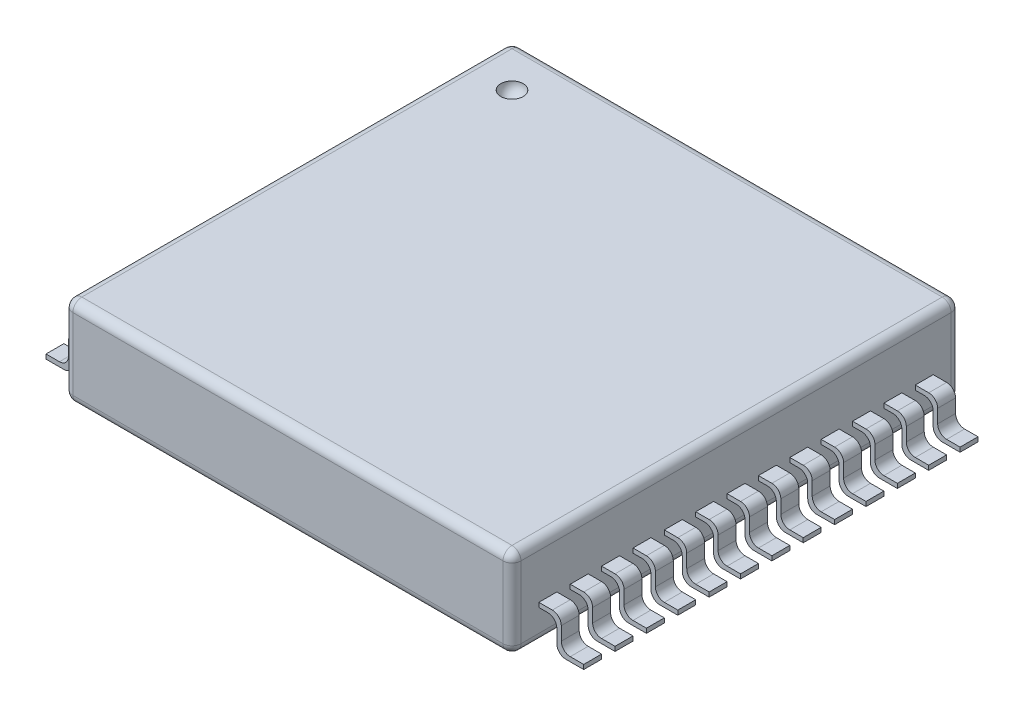
from build123d import *

# Parameters (mm, degrees)
SKETCH_1_W                         = 10
SKETCH_1_H                         = 10
EXTRUDE_1_DEPTH                    = 2
SKETCH_2_W                         = 0.4
SKETCH_2_H                         = 0.1
EXTRUDE_2_DEPTH                    = 0.2
FILLET_1_R                         = 0.2
PATTERN_LINEAR_1_COUNT             = 7
PATTERN_LINEAR_1_PITCH             = 0.7
FILLET_1_OF_PATTERN_LINEAR_1_R     = 0.2
PATTERN_LINEAR_1_COL_COUNT         = 7
PATTERN_LINEAR_1_COL_PITCH         = 0.7
FILLET_1_OF_PATTERN_LINEAR_1_COL_R = 0.2
FILLET_2_R                         = 0.2


# Read off the part's stored shape, not the designer's step: 镜向1
with BuildPart() as part:
    # 草图1 → 凸台-拉伸1 (new body)
    with BuildSketch(Plane(origin=(0, 0, 0), x_dir=(1, 0, 0), z_dir=(0, 1, 0))):
        Rectangle(SKETCH_1_W, SKETCH_1_H)
    extrude(amount=EXTRUDE_1_DEPTH)

    # 草图2 → 凸台-拉伸2 (add, symmetric)
    with BuildSketch(Plane.XY):
        Polygon((5.5, 0.8), (5.4, 0.8), (5.4, 0.7), (5.4, 0), (6, 0), (6, 0.1), (5.5, 0.1), align=None)
        with Locations((5.2, 0.75)):
            Rectangle(SKETCH_2_W, SKETCH_2_H)
    extrude_2 = extrude(amount=EXTRUDE_2_DEPTH, both=True)

    # 圆角1
    fillet_1_edges = [part.edges().sort_by_distance(p)[0] for p in [
        (5.4, 0.7, 0),
        (5.4, 0, 0),
        (5.5, 0.1, 0),
        (5.5, 0.8, 0),
    ]]
    fillet(fillet_1_edges, radius=FILLET_1_R)

    # 阵列(线性)1: 凸台-拉伸2 ×7
    with Locations(*[(0, 0, i * PATTERN_LINEAR_1_PITCH) for i in range(1, PATTERN_LINEAR_1_COUNT)]):
        add(extrude_2)

    # 圆角1 of 阵列(线性)1
    fillet_1_of_pattern_linear_1_edges = [part.edges().sort_by_distance(p)[0] for p in [
        (5.4, 0.7, 0.7),
        (5.4, 0, 0.7),
        (5.5, 0.1, 0.7),
        (5.5, 0.8, 0.7),
        (5.4, 0.7, 1.4),
        (5.4, 0, 1.4),
        (5.5, 0.1, 1.4),
        (5.5, 0.8, 1.4),
        (5.4, 0.7, 2.1),
        (5.4, 0, 2.1),
        (5.5, 0.1, 2.1),
        (5.5, 0.8, 2.1),
        (5.4, 0.7, 2.8),
        (5.4, 0, 2.8),
        (5.5, 0.1, 2.8),
        (5.5, 0.8, 2.8),
        (5.4, 0.7, 3.5),
        (5.4, 0, 3.5),
        (5.5, 0.1, 3.5),
        (5.5, 0.8, 3.5),
        (5.4, 0.7, 4.2),
        (5.4, 0, 4.2),
        (5.5, 0.1, 4.2),
        (5.5, 0.8, 4.2),
    ]]
    fillet(fillet_1_of_pattern_linear_1_edges, radius=FILLET_1_OF_PATTERN_LINEAR_1_R)

    # 阵列(线性)1 col: 凸台-拉伸2 ×7
    with Locations(*[(0, 0, -i * PATTERN_LINEAR_1_COL_PITCH) for i in range(1, PATTERN_LINEAR_1_COL_COUNT)]):
        add(extrude_2)

    # 圆角1 of 阵列(线性)1 col
    fillet_1_of_pattern_linear_1_col_edges = [part.edges().sort_by_distance(p)[0] for p in [
        (5.4, 0.7, -0.7),
        (5.4, 0, -0.7),
        (5.5, 0.1, -0.7),
        (5.5, 0.8, -0.7),
        (5.4, 0.7, -1.4),
        (5.4, 0, -1.4),
        (5.5, 0.1, -1.4),
        (5.5, 0.8, -1.4),
        (5.4, 0.7, -2.1),
        (5.4, 0, -2.1),
        (5.5, 0.1, -2.1),
        (5.5, 0.8, -2.1),
        (5.4, 0.7, -2.8),
        (5.4, 0, -2.8),
        (5.5, 0.1, -2.8),
        (5.5, 0.8, -2.8),
        (5.4, 0.7, -3.5),
        (5.4, 0, -3.5),
        (5.5, 0.1, -3.5),
        (5.5, 0.8, -3.5),
        (5.4, 0.7, -4.2),
        (5.4, 0, -4.2),
        (5.5, 0.1, -4.2),
        (5.5, 0.8, -4.2),
    ]]
    fillet(fillet_1_of_pattern_linear_1_col_edges, radius=FILLET_1_OF_PATTERN_LINEAR_1_COL_R)

    # 镜向1: part across plane


with BuildPart() as part_1:
    add(part.part)
    add(part.part.mirror(Plane(origin=(0, 0, 0), x_dir=(0, 0, 1), z_dir=(1, 0, 0))))

    # 圆角2
    fillet_2_edges = [part_1.edges().sort_by_distance(p)[0] for p in [
        (-5, 2, 0),
        (0, 2, 5),
        (5, 2, 0),
        (0, 0, 5),
        (-5, 0, 0),
        (0, 0, -5),
        (5, 0, 0),
        (0, 2, -5),
        (5, 1, 5),
        (-5, 1, 5),
        (-5, 1, -5),
        (5, 1, -5),
    ]]
    fillet(fillet_2_edges, radius=FILLET_2_R)

    # 草图3 → 切除-旋转3 (revolve, cut)
    with BuildSketch(Plane(origin=(0, 2, 0), x_dir=(1, 0, 0), z_dir=(0, 1, 0))):
        with BuildLine():
            Line((-4.25, 4), (-3.75, 4))
            ThreePointArc((-3.75, 4), (-4, 3.75), (-4.25, 4))
        make_face()
    revolve(axis=Axis((-4.37163107, 2, -4), (1, 0, 0)), mode=Mode.SUBTRACT)


solid = part_1.part
